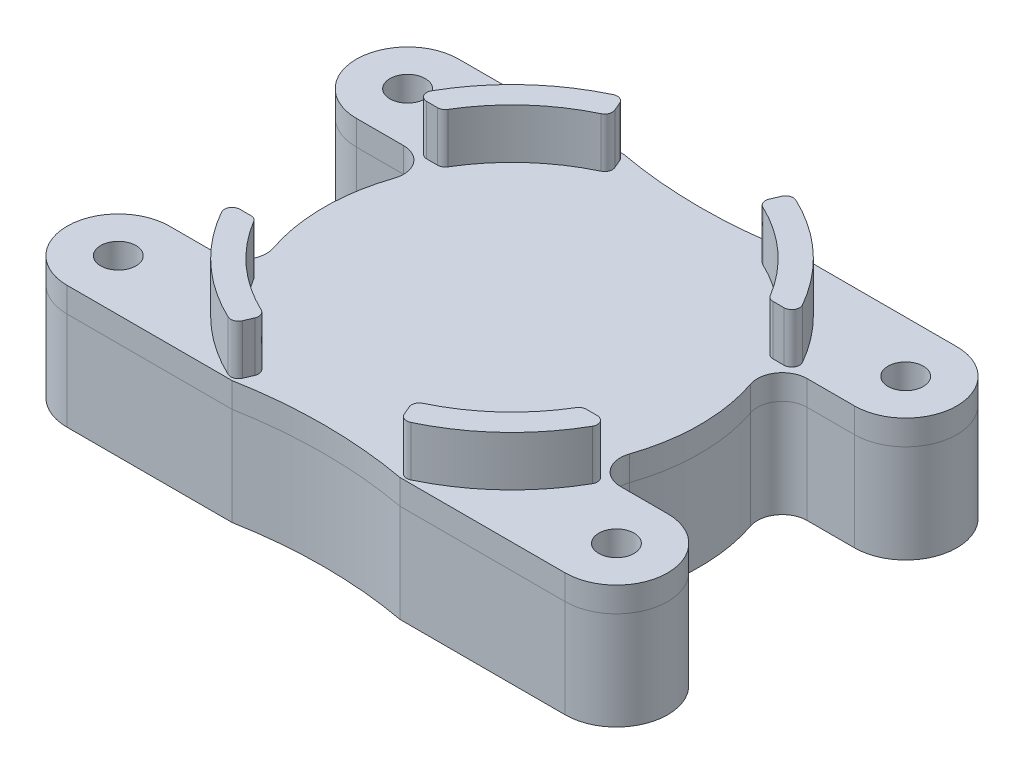
from build123d import *

# Parameters (mm, degrees)
SKETCH13_R                          = 1.8
BOSS_EXTRUDE6_DEPTH                 = 10
BOSS_EXTRUDE7_DEPTH                 = 2.54
CUT_EXTRUDE3_DEPTH                  = 38.906338731
CUT_EXTRUDE4_DEPTH                  = 38.906338731
BOSS_EXTRUDE8_START                 = 5.08
BOSS_EXTRUDE8_DEPTH                 = 5.08
BOSS_EXTRUDE9_START                 = 5.08
BOSS_EXTRUDE9_DEPTH                 = 5.08
BOSS_EXTRUDE10_START                = 5.08
BOSS_EXTRUDE10_DEPTH                = 5.08
BOSS_EXTRUDE11_START                = 5.08
BOSS_EXTRUDE11_DEPTH                = 5.08
SKETCH40_W                          = 1.8
SKETCH40_H                          = 7.62
F_3_6_3_6_DIAMETER_HOLE2_AT_2_COUNT = 2
F_3_6_3_6_DIAMETER_HOLE2_AT_2_PITCH = 29.4999896
F_3_6_3_6_DIAMETER_HOLE2_AT_3_COUNT = 2
F_3_6_3_6_DIAMETER_HOLE2_AT_3_PITCH = 58.744271094
F_3_6_3_6_DIAMETER_HOLE2_AT_4_COUNT = 2
F_3_6_3_6_DIAMETER_HOLE2_AT_4_PITCH = 50.8
FILLET2_START                       = 12.54
FILLET2_DEPTH                       = 6.46


with BuildPart() as part:
    # Sketch13 → Boss-Extrude6 (new body)
    with BuildSketch(Plane(origin=(0, 10, 0), x_dir=(1, 0, 0), z_dir=(0, 1, 0))):
        with BuildLine():
            Line((8.562572408, -19.9749896), (25.4, -19.9749896))
            ThreePointArc((25.4, -19.9749896), (30.6249948, -14.7499948), (25.4, -9.525))
            Line((25.4, -9.525), (20.579786947, -9.525))
            ThreePointArc((20.579786947, -9.525), (18.515185258, -8.464533666), (18.174552534, -6.168637692))
            ThreePointArc((18.174552534, -6.168637692), (19.192875, 0), (18.174552534, 6.168637692))
            ThreePointArc((18.174552534, 6.168637692), (18.515185258, 8.464533666), (20.579786947, 9.525))
            Line((20.579786947, 9.525), (25.4, 9.525))
            ThreePointArc((25.4, 9.525), (30.6249948, 14.7499948), (25.4, 19.9749896))
            Line((25.4, 19.9749896), (8.562572408, 19.9749896))
            ThreePointArc((8.562572408, 19.9749896), (0, 19.192875), (-8.562572408, 19.9749896))
            Line((-8.562572408, 19.9749896), (-25.4, 19.9749896))
            ThreePointArc((-25.4, 19.9749896), (-30.6249948, 14.7499948), (-25.4, 9.525))
            Line((-25.4, 9.525), (-20.579786947, 9.525))
            ThreePointArc((-20.579786947, 9.525), (-18.515185258, 8.464533666), (-18.174552534, 6.168637692))
            ThreePointArc((-18.174552534, 6.168637692), (-19.192875, 0), (-18.174552534, -6.168637692))
            ThreePointArc((-18.174552534, -6.168637692), (-18.515185258, -8.464533666), (-20.579786947, -9.525))
            Line((-20.579786947, -9.525), (-25.4, -9.525))
            ThreePointArc((-25.4, -9.525), (-30.6249948, -14.7499948), (-25.4, -19.9749896))
            Line((-25.4, -19.9749896), (-8.562572408, -19.9749896))
            ThreePointArc((-8.562572408, -19.9749896), (0, -19.192875), (8.562572408, -19.9749896))
        make_face()
        with Locations(Location((25.4, -14.7499948, 0), (0, 0, 270))):
            Circle(SKETCH13_R, mode=Mode.SUBTRACT)
        with Locations(Location((-25.4, 14.7499948, 0), (0, 0, 270))):
            Circle(SKETCH13_R, mode=Mode.SUBTRACT)
        with Locations(Location((-25.4, -14.7499948, 0), (0, 0, 270))):
            Circle(SKETCH13_R, mode=Mode.SUBTRACT)
        with Locations(Location((25.4, 14.7499948, 0), (0, 0, 270))):
            Circle(SKETCH13_R, mode=Mode.SUBTRACT)
    extrude(amount=-BOSS_EXTRUDE6_DEPTH)


with BuildPart() as body_2:
    # Sketch18 → Boss-Extrude7 (new body)
    with BuildSketch(Plane(origin=(0, 12.54, 0), x_dir=(1, 0, 0), z_dir=(0, 1, 0))):
        with BuildLine():
            Line((-25.4, -19.9749896), (25.4, -19.9749896))
            ThreePointArc((25.4, -19.9749896), (30.6249948, -14.7499948), (25.4, -9.525))
            Line((25.4, -9.525), (20.579786947, -9.525))
            ThreePointArc((20.579786947, -9.525), (18.515185258, -8.464533666), (18.174552534, -6.168637692))
            ThreePointArc((18.174552534, -6.168637692), (19.192875, 0), (18.174552534, 6.168637692))
            ThreePointArc((18.174552534, 6.168637692), (18.515185258, 8.464533666), (20.579786947, 9.525))
            Line((20.579786947, 9.525), (25.4, 9.525))
            ThreePointArc((25.4, 9.525), (30.6249948, 14.7499948), (25.4, 19.9749896))
            Line((25.4, 19.9749896), (-25.4, 19.9749896))
            ThreePointArc((-25.4, 19.9749896), (-30.6249948, 14.7499948), (-25.4, 9.525))
            Line((-25.4, 9.525), (-20.579786947, 9.525))
            ThreePointArc((-20.579786947, 9.525), (-18.515185258, 8.464533666), (-18.174552534, 6.168637692))
            ThreePointArc((-18.174552534, 6.168637692), (-19.192875, 0), (-18.174552534, -6.168637692))
            ThreePointArc((-18.174552534, -6.168637692), (-18.515185258, -8.464533666), (-20.579786947, -9.525))
            Line((-20.579786947, -9.525), (-25.4, -9.525))
            ThreePointArc((-25.4, -9.525), (-30.6249948, -14.7499948), (-25.4, -19.9749896))
        make_face()
    extrude(amount=-BOSS_EXTRUDE7_DEPTH)

    # Sketch19 → Cut-Extrude3 (cut, through all)
    with BuildSketch(Plane.XZ.offset(-10)):
        with BuildLine():
            Line((-8.562572408, -19.9749896), (8.562572408, -19.9749896))
            ThreePointArc((8.562572408, -19.9749896), (0, -19.192875), (-8.562572408, -19.9749896))
        make_face()
    extrude(amount=-CUT_EXTRUDE3_DEPTH, mode=Mode.SUBTRACT)

    # Sketch25 → Cut-Extrude4 (cut, through all)
    with BuildSketch(Plane(origin=(0, 10, 0), x_dir=(-1, 0, 0), z_dir=(0, -1, 0))):
        with BuildLine():
            Line((-8.562572408, -19.9749896), (8.562572408, -19.9749896))
            ThreePointArc((8.562572408, -19.9749896), (0, -19.192875), (-8.562572408, -19.9749896))
        make_face()
    extrude(amount=-CUT_EXTRUDE4_DEPTH, mode=Mode.SUBTRACT)

    # Sketch31 → Boss-Extrude8 (add)
    with BuildSketch(Plane(origin=(0, 12.54, 0), x_dir=(1, 0, 0), z_dir=(0, 1, 0)).offset(BOSS_EXTRUDE8_START)):
        with BuildLine():
            Line((8.562572408, -19.9749896), (7.561833485, -17.640440049))
            ThreePointArc((7.561833485, -17.640440049), (12.7738159, -14.324666771), (16.6625576, -9.525))
            Line((16.6625576, -9.525), (18.220053628, -9.525))
            ThreePointArc((18.220053628, -9.525), (18.905808972, -9.919026758), (18.910730414, -10.709908074))
            ThreePointArc((18.910730414, -10.709908074), (14.496759152, -16.191412225), (8.562572408, -19.9749896))
        make_face()
    extrude(amount=-BOSS_EXTRUDE8_DEPTH)

    # Sketch32 → Boss-Extrude9 (add)
    with BuildSketch(Plane(origin=(0, 12.54, 0), x_dir=(-1, 0, 0), z_dir=(0, 1, 0)).offset(BOSS_EXTRUDE9_START)):
        with BuildLine():
            Line((-18.220053628, -9.525), (-16.6625576, -9.525))
            ThreePointArc((-16.6625576, -9.525), (-12.7738159, -14.324666771), (-7.561833485, -17.640440049))
            Line((-7.561833485, -17.640440049), (-8.562572408, -19.9749896))
            ThreePointArc((-8.562572408, -19.9749896), (-14.496759152, -16.191412225), (-18.910730414, -10.709908074))
            ThreePointArc((-18.910730414, -10.709908074), (-18.905808972, -9.919026758), (-18.220053628, -9.525))
        make_face()
    extrude(amount=-BOSS_EXTRUDE9_DEPTH)

    # Sketch33 → Boss-Extrude10 (add)
    with BuildSketch(Plane(origin=(0, 12.54, 0), x_dir=(-1, 0, 0), z_dir=(0, 1, 0)).offset(BOSS_EXTRUDE10_START)):
        with BuildLine():
            Line((8.562572408, -19.9749896), (7.561833485, -17.640440049))
            ThreePointArc((7.561833485, -17.640440049), (12.7738159, -14.324666771), (16.6625576, -9.525))
            Line((16.6625576, -9.525), (18.220053628, -9.525))
            ThreePointArc((18.220053628, -9.525), (18.905808972, -9.919026758), (18.910730414, -10.709908074))
            ThreePointArc((18.910730414, -10.709908074), (14.496759152, -16.191412225), (8.562572408, -19.9749896))
        make_face()
    extrude(amount=-BOSS_EXTRUDE10_DEPTH)

    # Sketch39 → Boss-Extrude11 (add)
    with BuildSketch(Plane(origin=(0, 12.54, 0), x_dir=(1, 0, 0), z_dir=(0, 1, 0)).offset(BOSS_EXTRUDE11_START)):
        with BuildLine():
            Line((-18.220053628, -9.525), (-16.6625576, -9.525))
            ThreePointArc((-16.6625576, -9.525), (-12.7738159, -14.324666771), (-7.561833485, -17.640440049))
            Line((-7.561833485, -17.640440049), (-8.562572408, -19.9749896))
            ThreePointArc((-8.562572408, -19.9749896), (-14.496759152, -16.191412225), (-18.910730414, -10.709908074))
            ThreePointArc((-18.910730414, -10.709908074), (-18.905808972, -9.919026758), (-18.220053628, -9.525))
        make_face()
    extrude(amount=-BOSS_EXTRUDE11_DEPTH)

    # Sketch40 → Ø3.6 (3.6) Diameter Hole2 (revolve, cut)
    with BuildSketch(Plane(origin=(25.4, 10, 14.7499948), x_dir=(0, 0, -1), z_dir=(1, 0, 0))):
        with Locations((0.9, 3.81)):
            Rectangle(SKETCH40_W, SKETCH40_H)
    f_3_6_3_6_diameter_hole2 = revolve(axis=Axis((25.4, 3.65, 14.7499948), (0, 1, 0)), mode=Mode.SUBTRACT)

    # Ø3.6 (3.6) Diameter Hole2 at 2: Ø3.6 (3.6) Diameter Hole2 ×2
    with Locations(*[(0, 0, -i * F_3_6_3_6_DIAMETER_HOLE2_AT_2_PITCH) for i in range(1, F_3_6_3_6_DIAMETER_HOLE2_AT_2_COUNT)]):
        add(f_3_6_3_6_diameter_hole2, mode=Mode.SUBTRACT)

    # Ø3.6 (3.6) Diameter Hole2 at 3: Ø3.6 (3.6) Diameter Hole2 ×2
    with Locations(*[Vector(-0.8647651771601071, 0, -0.5021764514304196) * (i * F_3_6_3_6_DIAMETER_HOLE2_AT_3_PITCH) for i in range(1, F_3_6_3_6_DIAMETER_HOLE2_AT_3_COUNT)]):
        add(f_3_6_3_6_diameter_hole2, mode=Mode.SUBTRACT)

    # Ø3.6 (3.6) Diameter Hole2 at 4: Ø3.6 (3.6) Diameter Hole2 ×2
    with Locations(*[(-i * F_3_6_3_6_DIAMETER_HOLE2_AT_4_PITCH, 0, 0) for i in range(1, F_3_6_3_6_DIAMETER_HOLE2_AT_4_COUNT)]):
        add(f_3_6_3_6_diameter_hole2, mode=Mode.SUBTRACT)

    # Fillet2: read off the stored shape, not the designer's step
    # Fillet2 outline → Fillet2 (cut)
    with BuildSketch(Plane(origin=(0, 0, 0), x_dir=(1, 0, 0), z_dir=(0, 1, 0)).offset(FILLET2_START)):
        with BuildLine():
            Line((-8.562572408, -19.9749896), (-8.243911939, -19.231610246))
            ThreePointArc((-8.243911939, -19.231610246), (-8.692749802, -19.66133579), (-9.31362011, -19.636046858))
            ThreePointArc((-9.31362011, -19.636046858), (-8.939702751, -19.809077982), (-8.562572408, -19.9749896))
        make_face()
        with BuildLine():
            ThreePointArc((-17.116909106, -9.525), (-16.726549814, -9.627621441), (-16.437127171, -9.908950556))
            ThreePointArc((-16.437127171, -9.908950556), (-16.550955788, -9.717628994), (-16.6625576, -9.525))
            Line((-16.6625576, -9.525), (-17.116909106, -9.525))
        make_face()
        with BuildLine():
            ThreePointArc((-8.256441319, -17.326212151), (-7.855188873, -17.762725914), (-7.868352041, -18.355494436))
            Line((-7.868352041, -18.355494436), (-7.561833485, -17.640440049))
            ThreePointArc((-7.561833485, -17.640440049), (-7.910697772, -17.486775333), (-8.256441319, -17.326212151))
        make_face()
        with BuildLine():
            ThreePointArc((-8.562572408, 19.9749896), (-8.939702751, 19.809077982), (-9.31362011, 19.636046858))
            ThreePointArc((-9.31362011, 19.636046858), (-8.692749802, 19.66133579), (-8.243911939, 19.231610246))
            Line((-8.243911939, 19.231610246), (-8.562572408, 19.9749896))
        make_face()
        with BuildLine():
            ThreePointArc((-16.6625576, 9.525), (-16.550955788, 9.717628994), (-16.437127171, 9.908950556))
            ThreePointArc((-16.437127171, 9.908950556), (-16.726549814, 9.627621441), (-17.116909106, 9.525))
            Line((-17.116909106, 9.525), (-16.6625576, 9.525))
        make_face()
        with BuildLine():
            Line((-7.561833485, 17.640440049), (-7.868352041, 18.355494436))
            ThreePointArc((-7.868352041, 18.355494436), (-7.855188873, 17.762725914), (-8.256441319, 17.326212151))
            ThreePointArc((-8.256441319, 17.326212151), (-7.910697772, 17.486775333), (-7.561833485, 17.640440049))
        make_face()
        with BuildLine():
            Line((8.562572408, 19.9749896), (8.243911939, 19.231610246))
            ThreePointArc((8.243911939, 19.231610246), (8.692749802, 19.66133579), (9.31362011, 19.636046858))
            ThreePointArc((9.31362011, 19.636046858), (8.939702751, 19.809077982), (8.562572408, 19.9749896))
        make_face()
        with BuildLine():
            ThreePointArc((17.116909106, 9.525), (16.726549814, 9.627621441), (16.437127171, 9.908950556))
            ThreePointArc((16.437127171, 9.908950556), (16.550955788, 9.717628994), (16.6625576, 9.525))
            Line((16.6625576, 9.525), (17.116909106, 9.525))
        make_face()
        with BuildLine():
            ThreePointArc((8.256441319, 17.326212151), (7.855188873, 17.762725914), (7.868352041, 18.355494436))
            Line((7.868352041, 18.355494436), (7.561833485, 17.640440049))
            ThreePointArc((7.561833485, 17.640440049), (7.910697772, 17.486775333), (8.256441319, 17.326212151))
        make_face()
        with BuildLine():
            ThreePointArc((16.6625576, -9.525), (16.550955788, -9.717628994), (16.437127171, -9.908950556))
            ThreePointArc((16.437127171, -9.908950556), (16.726549814, -9.627621441), (17.116909106, -9.525))
            Line((17.116909106, -9.525), (16.6625576, -9.525))
        make_face()
        with BuildLine():
            ThreePointArc((9.31362011, -19.636046858), (8.692749802, -19.66133579), (8.243911939, -19.231610246))
            Line((8.243911939, -19.231610246), (8.562572408, -19.9749896))
            ThreePointArc((8.562572408, -19.9749896), (8.939702751, -19.809077982), (9.31362011, -19.636046858))
        make_face()
        with BuildLine():
            ThreePointArc((7.868352041, -18.355494436), (7.855188873, -17.762725914), (8.256441319, -17.326212151))
            ThreePointArc((8.256441319, -17.326212151), (7.910697772, -17.486775333), (7.561833485, -17.640440049))
            Line((7.561833485, -17.640440049), (7.868352041, -18.355494436))
        make_face()
    extrude(amount=FILLET2_DEPTH, mode=Mode.SUBTRACT)


solid = Compound([part.part, body_2.part])
